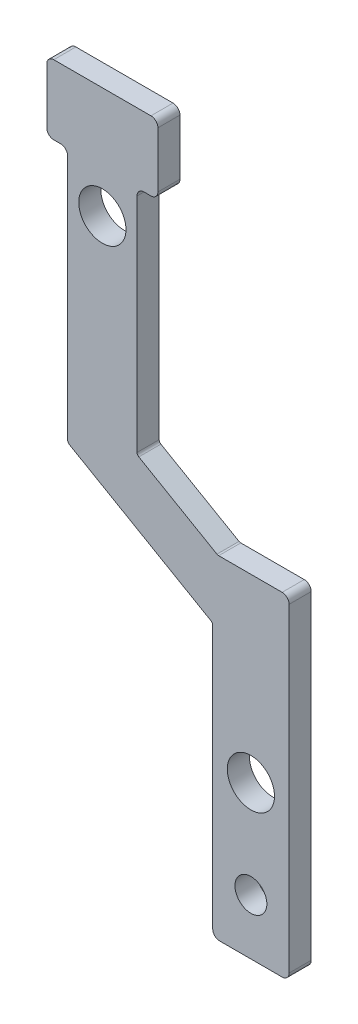
from build123d import *

# Parameters (mm, degrees)
BOARD_DEPTH                  = 1.59144
M3_CLEARANCE_HOLE1_OUTLINE_R = 1.7
M3_CLEARANCE_HOLE1_DEPTH     = 1.59144
SKETCH7_R                    = 1.15
CUTOUT_2_DEPTH               = 53.216689419


# Read off the part's stored shape, not the designer's step: M3 Clearance Hole1
with BuildPart() as part:
    # Sketch1 → Board (new body)
    with BuildSketch(Plane.XY):
        with BuildLine():
            Line((8.00627, 44.00635), (7.50627, 44.00635))
            ThreePointArc((7.50627, 44.00635), (7.152716609, 43.859903391), (7.00627, 43.50635))
            Line((7.00627, 43.50635), (7.00627, 27.50635))
            ThreePointArc((7.00627, 27.50635), (7.039763649, 27.38135), (7.13127, 27.289843649))
            Line((7.13127, 27.289843649), (12.760435125, 24.039843649))
            ThreePointArc((12.760435125, 24.039843649), (12.820730363, 24.014868543), (12.885435125, 24.00635))
            Line((12.885435125, 24.00635), (17.45627, 24.00635))
            ThreePointArc((17.45627, 24.00635), (17.809823391, 23.859903391), (17.95627, 23.50635))
            Line((17.95627, 23.50635), (17.95627, 0.50635))
            ThreePointArc((17.95627, 0.50635), (17.809823391, 0.152796609), (17.45627, 0.00635))
            Line((17.45627, 0.00635), (12.95627, 0.00635))
            ThreePointArc((12.95627, 0.00635), (12.602716609, 0.152796609), (12.45627, 0.50635))
            Line((12.45627, 0.50635), (12.45627, 19.452313745))
            ThreePointArc((12.45627, 19.452313745), (12.422776351, 19.577313745), (12.33127, 19.668820096))
            Line((12.33127, 19.668820096), (2.13127, 25.557792841))
            ThreePointArc((2.13127, 25.557792841), (2.039763649, 25.649299192), (2.00627, 25.774299192))
            Line((2.00627, 25.774299192), (2.00627, 43.50635))
            ThreePointArc((2.00627, 43.50635), (1.859823391, 43.859903391), (1.50627, 44.00635))
            Line((1.50627, 44.00635), (1.00627, 44.00635))
            ThreePointArc((1.00627, 44.00635), (0.652716609, 44.152796609), (0.50627, 44.50635))
            Line((0.50627, 44.50635), (0.50627, 48.50635))
            ThreePointArc((0.50627, 48.50635), (0.652716609, 48.859903391), (1.00627, 49.00635))
            Line((1.00627, 49.00635), (8.00627, 49.00635))
            ThreePointArc((8.00627, 49.00635), (8.359823391, 48.859903391), (8.50627, 48.50635))
            Line((8.50627, 48.50635), (8.50627, 44.50635))
            ThreePointArc((8.50627, 44.50635), (8.359823391, 44.152796609), (8.00627, 44.00635))
        make_face()
    extrude(amount=BOARD_DEPTH)

    # M3 Clearance Hole1 outline → M3 Clearance Hole1 (cut)
    with BuildSketch(Plane.XY):
        with Locations((15.20627, 11.00635)):
            Circle(M3_CLEARANCE_HOLE1_OUTLINE_R)
        with Locations((4.50627, 41.00635)):
            Circle(M3_CLEARANCE_HOLE1_OUTLINE_R)
    extrude(amount=M3_CLEARANCE_HOLE1_DEPTH, mode=Mode.SUBTRACT)

    # Sketch7 → Cutout 2 (cut, through all)
    with BuildSketch(Plane.XY.offset(1.59144)):
        with Locations((15.206, 4.006)):
            Circle(SKETCH7_R)
    extrude(amount=-CUTOUT_2_DEPTH, mode=Mode.SUBTRACT)


solid = part.part
